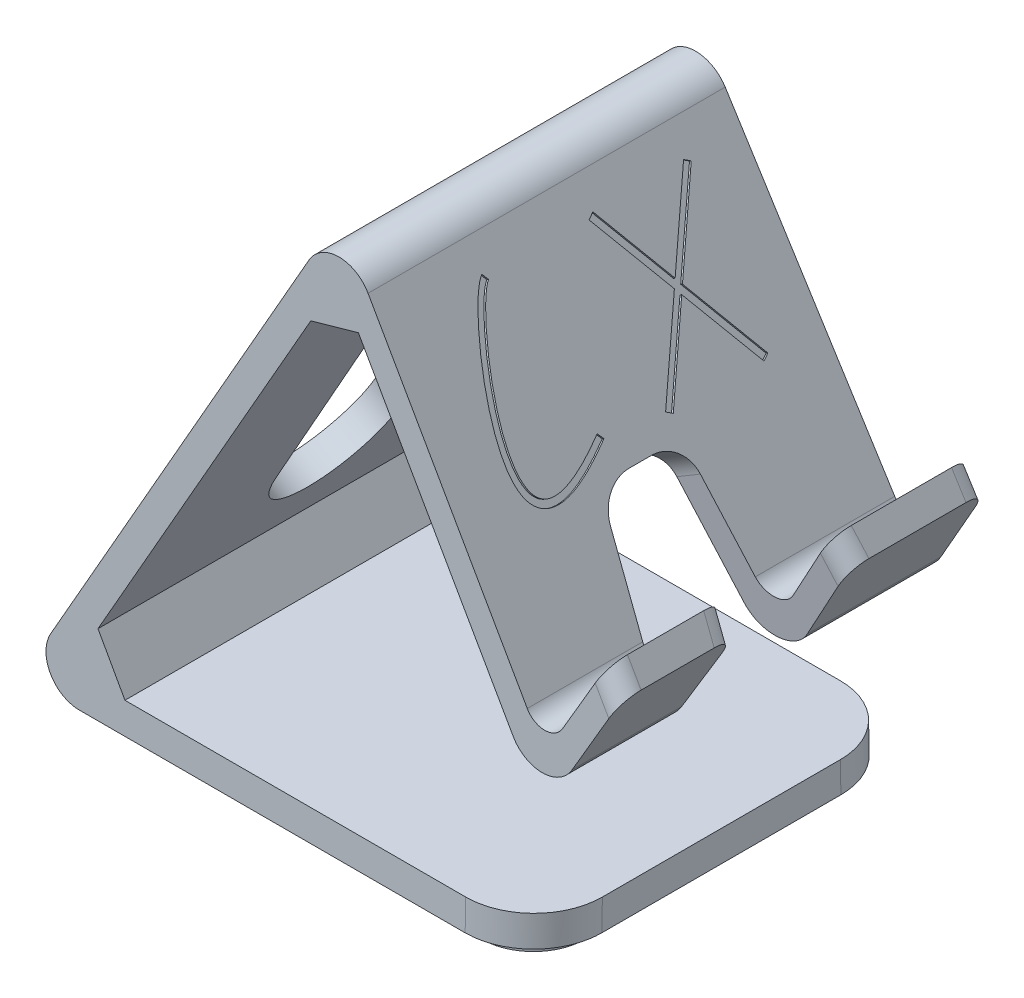
from build123d import *

# Parameters (mm, degrees)
EXTRUDE_6_DEPTH                 = 55
CUT_EXTRUDE_4_DEPTH             = 123.678441464
CUT_EXTRUDE_4_DEPTH_BACK        = 123.678441464
CUT_EXTRUDE_5_REACH             = 115.734
CUT_EXTRUDE_5_DIRECTION_2_DEPTH = 114.733582127
FILLET_2_R                      = 10
CHAMFER_4_SIZE                  = 8
FILLET_4_R                      = 5
CHAMFER_5_SIZE                  = 8
CHAMFER_5_SIZE2                 = 5.863195657
FILLET_5_R                      = 5
FILLET_6_R                      = 3
FILLET_7_R                      = 3
CUT_EXTRUDE_6_REACH             = 111.311
SKETCH_22_R                     = 7.610034459
EXTRUDE_7_DEPTH                 = 2
CUT_EXTRUDE_START               = -0.3
CUT_EXTRUDE_7_DEPTH             = 0.3
FILLET_8_R                      = 5
CUT_EXTRUDE_1_DEPTH             = 0.3


# Read off the part's stored shape, not the designer's step: 切除-拉伸7, 切除-拉伸-薄壁1
with BuildPart() as part:
    # 草图17 → 凸台-拉伸6 (new body)
    with BuildSketch(Plane.XY):
        Polygon((0, 0), (-45, 0), (0, 80), (31.106425199, 28), (39.977057886, 43.36438651), (42.033624536, 39.926464437), (30.873796317, 20.597074957), (0.106425199, 72.030284909), (-37.879360062, 4.5), (-3.8431044, 4.5), (30, 4.5), (30, 0), align=None)
    extrude(amount=EXTRUDE_6_DEPTH)

    # 草图18 → 切除-拉伸4 (cut, two sides: drawn at the far end of the back side and taken through both)
    with BuildSketch(Plane(origin=(30, 0, 0), x_dir=(0, 0, -1), z_dir=(1, 0, 0)).offset(-CUT_EXTRUDE_4_DEPTH_BACK)):
        Polygon((-55, 0), (-53.5, 80), (-55, 80), align=None)
        Polygon((0, 80), (0, 0), (-1.5, 80), align=None)
    extrude(amount=CUT_EXTRUDE_4_DEPTH + CUT_EXTRUDE_4_DEPTH_BACK, mode=Mode.SUBTRACT)

    # 草图20 → 切除-拉伸5 (cut, up to next)
    with BuildSketch(Plane(origin=(35.244140799, 21.083062105, 0), x_dir=(0, 0, -1), z_dir=(0.8581734811109417, 0.5133597922684716, 0)), mode=Mode.PRIVATE) as cut_extrude_5_sk1:
        Polygon((-23.257770773, 29.934997092), (-35.257770773, 29.934997092), (-39.257770773, -0.065002908), (-19.257770773, -0.065002908), align=None)
    cut_extrude_5_tool1 = extrude(cut_extrude_5_sk1.sketch, amount=-CUT_EXTRUDE_5_REACH, mode=Mode.PRIVATE) & part.part
    add(cut_extrude_5_tool1.solids().sort_by_distance((28.218814, 32.827164, 29.257771))[0], mode=Mode.SUBTRACT)

    # 草图20 → 切除-拉伸5 direction 2 (cut)
    with BuildSketch(Plane(origin=(35.244140799, 21.083062105, 0), x_dir=(0, 0, -1), z_dir=(0.8581734811109417, 0.5133597922684716, 0))):
        Polygon((-23.257770773, 29.934997092), (-35.257770773, 29.934997092), (-39.257770773, -0.065002908), (-19.257770773, -0.065002908), align=None)
    extrude(amount=CUT_EXTRUDE_5_DIRECTION_2_DEPTH, mode=Mode.SUBTRACT)

    # 圆角2
    fillet_2_edges = [part.edges().sort_by_distance(p)[0] for p in [
        (30, 2.25, 54.9578125),
        (30, 2.25, 0.0421875),
    ]]
    fillet(fillet_2_edges, radius=FILLET_2_R)

    # 倒角4
    chamfer_4_edges = [part.edges().sort_by_distance(p)[0] for p in [
        (-37.879360062, 4.5, 27.5),
    ]]
    chamfer(chamfer_4_edges, length=CHAMFER_4_SIZE)

    # 圆角4
    fillet_4_edges = [part.edges().sort_by_distance(p)[0] for p in [
        (-45, 0, 27.5),
        (0, 80, 27.5),
    ]]
    fillet(fillet_4_edges, radius=FILLET_4_R)

    # 倒角5
    chamfer_5_edges = [part.edges().sort_by_distance(p)[0] for p in [
        (0.106425199, 72.030284909, 27.5),
    ]]
    chamfer_5_side = [part.faces().sort_by_distance(p)[0] for p in [
        (-17.046062304, 41.536973792, 27.5),
    ]]
    chamfer(chamfer_5_edges, length=CHAMFER_5_SIZE, length2=CHAMFER_5_SIZE2, reference=chamfer_5_side[0])

    # 圆角5
    fillet_5_edges = [part.edges().sort_by_distance(p)[0] for p in [
        (30.873796317, 20.597074957, 9.948083015),
        (30.873796317, 20.597074957, 46.809687758),
    ]]
    fillet(fillet_5_edges, radius=FILLET_5_R)

    # 圆角6
    fillet_6_edges = [part.edges().sort_by_distance(p)[0] for p in [
        (31.106425199, 28, 46.324713893),
        (31.106425199, 28, 10.43305688),
    ]]
    fillet(fillet_6_edges, radius=FILLET_6_R)

    # 圆角7
    fillet_7_edges = [part.edges().sort_by_distance(p)[0] for p in [
        (41.005341211, 41.645425473, 21.224905335),
        (41.005341211, 41.645425473, 37.290636212),
        (41.005341211, 41.645425473, 54.219148272),
        (41.005341211, 41.645425473, 0.780851728),
    ]]
    fillet(fillet_7_edges, radius=FILLET_7_R)

    # 草图21 → 切除-拉伸6 (cut, up to next)
    with BuildSketch(Plane(origin=(-34.183976261, 19.228486647, 0), x_dir=(0, 0, 1), z_dir=(-0.8715755371245492, 0.4902612396325591, 0)), mode=Mode.PRIVATE) as cut_extrude_6_sk1:
        with BuildLine():
            Line((36.595829516, 45.814071294), (36.595829516, 9.320479087))
            ThreePointArc((36.595829516, 9.320479087), (27.509071617, 0.233721188), (18.422313717, 9.320479087))
            Line((18.422313717, 9.320479087), (18.422313717, 45.814071294))
            ThreePointArc((18.422313717, 45.814071294), (27.509071617, 54.900829194), (36.595829516, 45.814071294))
        make_face()
    cut_extrude_6_tool1 = extrude(cut_extrude_6_sk1.sketch, amount=-CUT_EXTRUDE_6_REACH, mode=Mode.PRIVATE) & part.part
    add(cut_extrude_6_tool1.solids().sort_by_distance((-20.66881, 43.255449, 27.509072))[0], mode=Mode.SUBTRACT)

    # 草图22 → 凸台-拉伸7 (add)
    with BuildSketch(Plane.XZ):
        with Locations(Location((20, 44.998242342, 0), (0, 0, 90))):
            Circle(SKETCH_22_R)
        with Locations(Location((20, 10.001757658, 0), (0, 0, 90))):
            Circle(SKETCH_22_R)
        with Locations(Location((-27.513233718, 26.892921796, 0), (0, 0, 90))):
            Circle(SKETCH_22_R)
    extrude(amount=EXTRUDE_7_DEPTH)

    # 切除-拉伸7 outline → 切除-拉伸7 (cut)
    with BuildSketch(Plane(origin=(-34.183976261, 19.228486647, 0), x_dir=(0, 0, 1), z_dir=(-0.8715755371245492, 0.4902612396325591, 0)).offset(CUT_EXTRUDE_START)):
        with BuildLine():
            add(Edge.make_bspline(
                [(20.091441542, -2.755271262), (20.076134397, -2.776993766), (20.048566677, -2.816115363), (20.010320312, -2.86930513), (19.983358443, -2.913234855), (19.958733151, -2.949133213), (19.9376434, -2.988511719), (19.914891341, -3.040593927), (19.880239013, -3.105882728), (19.829606692, -3.218529253), (19.762184157, -3.376781443), (19.714472085, -3.510185447), (19.68976923, -3.579255174)],
                knots=[0, 0, 0, 0, 0.086604777, 0.15597268, 0.213376287, 0.254512607, 0.297729061, 0.358675807, 0.43965503, 0.538420748, 0.76101802, 1, 1, 1, 1], degree=3))
            Line((20.091441542, -2.755271262), (19.732635445, -2.056710721))
            Line((19.732635445, -2.056710721), (19.430984302, -2.263103608))
            Line((19.430984302, -2.263103608), (19.580222236, -2.277392346))
            Line((19.580222236, -2.277392346), (19.411932651, -2.448857207))
            add(Edge.make_bspline(
                [(19.161085911, -3.441130704), (19.182121003, -3.377218318), (19.2262479, -3.243144491), (19.284608985, -3.039580469), (19.336582241, -2.84662122), (19.373494084, -2.681680965), (19.398717089, -2.554150479), (19.408007685, -2.480128863), (19.411932651, -2.448857207)],
                knots=[0, 0, 0, 0, 0.19692034, 0.413094638, 0.619735605, 0.781697444, 0.907774473, 1, 1, 1, 1], degree=3))
            Line((19.161085911, -3.441130704), (17.787779391, -7.407049417))
            add(Edge.make_bspline(
                [(17.254333159, -8.743840272), (17.257653132, -8.707879033), (17.263610586, -8.643349179), (17.269639056, -8.557710587), (17.280095056, -8.496143934), (17.289101292, -8.440126177), (17.322778871, -8.382485197), (17.371291346, -8.313345252), (17.423815093, -8.240474184), (17.470658871, -8.165791172), (17.508431189, -8.08551754), (17.554538675, -7.992881596), (17.606029189, -7.872032207), (17.667523789, -7.725717587), (17.731318887, -7.566870351), (17.769599544, -7.458510525), (17.787779391, -7.407049417)],
                knots=[0, 0, 0, 0, 0.074412067, 0.133527098, 0.176539601, 0.203262751, 0.249574269, 0.31155451, 0.378083901, 0.434356765, 0.492855524, 0.560623601, 0.647507607, 0.763305643, 0.887591607, 1, 1, 1, 1], degree=3))
            Line((17.254333159, -8.743840272), (17.255920796, -9.102646368))
            Line((17.255920796, -9.102646368), (17.251157884, -9.228069738))
            add(Edge.make_bspline(
                [(17.316251025, -9.391596411), (17.311431849, -9.394183906), (17.301117968, -9.399721598), (17.28463909, -9.385556092), (17.27458161, -9.363109337), (17.264118276, -9.322023237), (17.254329189, -9.276144785), (17.251997896, -9.240803806), (17.251157884, -9.228069738)],
                knots=[0, 0, 0, 0, 0.076663169, 0.16407263, 0.283387277, 0.459879146, 0.805383567, 1, 1, 1, 1], degree=3))
            add(Edge.make_bspline(
                [(17.89415111, -8.734314446), (17.859392091, -8.824068524), (17.791680033, -8.998913315), (17.670522096, -9.192240631), (17.566478549, -9.320496638), (17.483528039, -9.378481281), (17.397912072, -9.408670486), (17.343322044, -9.397256546), (17.316251025, -9.391596411)],
                knots=[0, 0, 0, 0, 0.305121637, 0.594390033, 0.721879203, 0.825883103, 0.913655992, 1, 1, 1, 1], degree=3))
            Line((17.89415111, -8.734314446), (18.143410212, -8.040516817))
            Line((18.143410212, -8.040516817), (19.68976923, -3.579255174))
        make_face()
        with BuildLine():
            add(Edge.make_bspline(
                [(32.481365335, -3.20616034), (32.455783647, -3.204896851), (32.40854624, -3.20256378), (32.344047761, -3.179158271), (32.298225284, -3.134927935), (32.272955003, -3.075595917), (32.263765855, -3.007558666), (32.263388366, -2.932603657), (32.277000859, -2.851331222), (32.294344308, -2.796876193), (32.303549924, -2.767972363)],
                knots=[0, 0, 0, 0, 0.132741281, 0.245111035, 0.348211214, 0.454063146, 0.573894196, 0.703170557, 0.842447835, 1, 1, 1, 1], degree=3))
            add(Edge.make_bspline(
                [(33.130709111, -2.745745437), (33.101557213, -2.798610192), (33.039333464, -2.91144824), (32.93290227, -3.038114669), (32.82656461, -3.13147901), (32.724506715, -3.178925122), (32.607780553, -3.206859983), (32.524932923, -3.206401464), (32.481365335, -3.20616034)],
                knots=[0, 0, 0, 0, 0.21267392, 0.453945354, 0.579961607, 0.708593919, 0.846756507, 1, 1, 1, 1], degree=3))
            add(Edge.make_bspline(
                [(32.303549924, -2.767972363), (32.31563674, -2.738309273), (32.344164313, -2.668297788), (32.394065532, -2.552402402), (32.472203674, -2.426122966), (32.559136174, -2.325085964), (32.648786335, -2.257023765), (32.734093895, -2.226022823), (32.831236666, -2.211859979), (32.934411912, -2.217642757), (33.031575375, -2.236722945), (33.112313955, -2.273826448), (33.165942265, -2.335797581), (33.18575091, -2.44238248), (33.180448788, -2.582149275), (33.147462749, -2.690641926), (33.130709111, -2.745745437)],
                knots=[0, 0, 0, 0, 0.060260207, 0.142227483, 0.236978024, 0.338488368, 0.391253471, 0.446710231, 0.507101831, 0.574854247, 0.640065641, 0.6925955, 0.739241005, 0.787525155, 0.892083842, 1, 1, 1, 1], degree=3))
        make_face()
        with BuildLine():
            add(Edge.make_bspline(
                [(34.98030691, -5.836875835), (34.990425973, -5.79296609), (35.009426465, -5.710517073), (35.035346716, -5.593661262), (35.055827278, -5.490941515), (35.078251535, -5.368648856), (35.096795379, -5.213527803), (35.099309901, -5.053642902), (35.095326123, -4.921886882), (35.080899881, -4.829821245), (35.058802228, -4.74693778), (35.027908058, -4.673988924), (34.986159595, -4.611023519), (34.930620512, -4.561977886), (34.861411615, -4.527924514), (34.810244134, -4.51694835), (34.783439848, -4.511198443)],
                knots=[0, 0, 0, 0, 0.090904411, 0.170690567, 0.241460043, 0.30219241, 0.421507994, 0.556066006, 0.624468594, 0.687131505, 0.743594276, 0.797145731, 0.846302562, 0.894711718, 0.94484432, 1, 1, 1, 1], degree=3))
            Line((34.98030691, -5.836875835), (35.307360254, -5.786071432))
            Line((35.307360254, -5.786071432), (35.426433074, -5.733679391))
            Line((35.426433074, -5.733679391), (35.534392431, -5.385986758))
            add(Edge.make_bspline(
                [(35.021585487, -3.985690399), (35.06522038, -3.998159596), (35.157445671, -4.024514086), (35.271570518, -4.071379618), (35.36400925, -4.124065065), (35.430559604, -4.180850955), (35.488310281, -4.255179269), (35.541383326, -4.34302772), (35.585259732, -4.447847424), (35.612193713, -4.570797999), (35.626618868, -4.710870104), (35.623392223, -4.862372785), (35.610421401, -5.01319767), (35.593868177, -5.15335781), (35.569843746, -5.276366327), (35.54563048, -5.351237136), (35.534392431, -5.385986758)],
                knots=[0, 0, 0, 0, 0.079309321, 0.167625607, 0.2149077, 0.26477983, 0.319394775, 0.378734052, 0.443850111, 0.517006848, 0.597924044, 0.689518136, 0.781406105, 0.862534574, 0.936198479, 1, 1, 1, 1], degree=3))
            add(Edge.make_bspline(
                [(32.883037647, -6.244898697), (32.943178094, -6.099626097), (33.061906429, -5.812831191), (33.234324418, -5.469912238), (33.376072066, -5.212048119), (33.481275059, -5.037869854), (33.581537931, -4.87938548), (33.715036369, -4.699907455), (33.877682233, -4.505411804), (34.080750059, -4.308242371), (34.295880846, -4.154486897), (34.489544406, -4.062077398), (34.650399084, -4.010537944), (34.773393973, -3.986121188), (34.897746838, -3.978440842), (34.980323984, -3.983274936), (35.021585487, -3.985690399)],
                knots=[0, 0, 0, 0, 0.142303331, 0.280933022, 0.347199509, 0.408660365, 0.465140664, 0.516886908, 0.611052707, 0.694418082, 0.77244854, 0.849384336, 0.88756924, 0.925154296, 0.962601684, 1, 1, 1, 1], degree=3))
            add(Edge.make_bspline(
                [(33.227555005, -9.170914785), (33.188900028, -9.171764975), (33.114047395, -9.173411308), (33.003842104, -9.161714633), (32.900179554, -9.1396773), (32.802596147, -9.108698468), (32.716053, -9.066253889), (32.640546913, -9.014954134), (32.57921136, -8.952516817), (32.517181526, -8.853370026), (32.465192426, -8.711046565), (32.424292896, -8.524425275), (32.403698965, -8.31889787), (32.399016216, -8.134088605), (32.407717508, -7.973098459), (32.420701153, -7.838083349), (32.439712481, -7.69130799), (32.47626979, -7.478763491), (32.537422601, -7.204654319), (32.639442257, -6.878260918), (32.756240613, -6.55836107), (32.841172637, -6.34839564), (32.883037647, -6.244898697)],
                knots=[0, 0, 0, 0, 0.032970742, 0.063845513, 0.094317936, 0.123311871, 0.150984664, 0.176293413, 0.200886792, 0.225066105, 0.275556496, 0.32924826, 0.387853738, 0.451551365, 0.486826669, 0.525386919, 0.567291064, 0.613104455, 0.709416956, 0.806711446, 0.904723485, 1, 1, 1, 1], degree=3))
            add(Edge.make_bspline(
                [(34.929502507, -7.264162033), (34.907303104, -7.32185676), (34.865551306, -7.430366821), (34.806730836, -7.582018436), (34.757395049, -7.712892509), (34.703721599, -7.856508532), (34.64048809, -8.016537613), (34.555145512, -8.197277899), (34.451535377, -8.373460006), (34.334819451, -8.551644447), (34.196945859, -8.722276014), (34.039611804, -8.873949707), (33.863053039, -9.003024665), (33.664636054, -9.097245682), (33.450194078, -9.158631262), (33.302048459, -9.166804805), (33.227555005, -9.170914785)],
                knots=[0, 0, 0, 0, 0.067695664, 0.127319444, 0.178123223, 0.220855275, 0.29521794, 0.366502184, 0.439462837, 0.518864455, 0.599599942, 0.679115683, 0.757600488, 0.837954442, 0.918517109, 1, 1, 1, 1], degree=3))
            Line((34.929502507, -7.264162033), (34.519892007, -7.264162033))
            Line((34.519892007, -7.264162033), (34.350014785, -7.62931868))
            add(Edge.make_bspline(
                [(33.372030026, -8.63270564), (33.422824729, -8.63223357), (33.519179092, -8.631338081), (33.652965212, -8.578573561), (33.76470057, -8.499191407), (33.85277216, -8.421313338), (33.922072181, -8.34570207), (33.978188616, -8.273416528), (34.042966692, -8.189816862), (34.131201983, -8.054112322), (34.243079891, -7.870105937), (34.314137329, -7.710104604), (34.350014785, -7.62931868)],
                knots=[0, 0, 0, 0, 0.102145031, 0.19376271, 0.285662339, 0.379075945, 0.43144347, 0.493238321, 0.564439619, 0.645630794, 0.821076217, 1, 1, 1, 1], degree=3))
            add(Edge.make_bspline(
                [(33.154523675, -7.1276252), (33.128011412, -7.239459316), (33.077446752, -7.452751334), (33.03765382, -7.717267568), (33.025461569, -7.913371657), (33.020793088, -8.046391223), (33.027515879, -8.168965934), (33.040903217, -8.279529007), (33.062463413, -8.375311732), (33.089709471, -8.454518618), (33.119495733, -8.518258686), (33.171839144, -8.577127602), (33.258099137, -8.621819545), (33.3328417, -8.628961196), (33.372030026, -8.63270564)],
                knots=[0, 0, 0, 0, 0.202646971, 0.38649191, 0.470668421, 0.549081373, 0.62103644, 0.686899776, 0.745306418, 0.793708227, 0.83461066, 0.86832314, 0.930960414, 1, 1, 1, 1], degree=3))
            add(Edge.make_bspline(
                [(34.783439848, -4.511198443), (34.749316471, -4.510231873), (34.678790491, -4.508234173), (34.571152078, -4.546558122), (34.46030601, -4.615810813), (34.365075629, -4.698597008), (34.281824017, -4.786208347), (34.210144039, -4.872595412), (34.133799498, -4.9778971), (34.016208713, -5.141002804), (33.872690507, -5.37293392), (33.73488769, -5.622544863), (33.624560143, -5.841364012), (33.546211226, -6.02963204), (33.459757544, -6.233994899), (33.382453499, -6.451403196), (33.309080914, -6.660683183), (33.245410036, -6.84532271), (33.193899738, -6.996831325), (33.166492283, -7.08786956), (33.154523675, -7.1276252)],
                knots=[0, 0, 0, 0, 0.03168376, 0.065483796, 0.104774276, 0.153560844, 0.182959816, 0.217741629, 0.258416085, 0.304548336, 0.405726053, 0.513142424, 0.571120559, 0.634729114, 0.703737933, 0.778565028, 0.850395376, 0.911110879, 0.96118286, 1, 1, 1, 1], degree=3))
        make_face()
        with BuildLine():
            add(Edge.make_bspline(
                [(37.518939425, -3.952350009), (37.560884339, -3.95552987), (37.641275307, -3.961624342), (37.755098372, -3.987176368), (37.856218481, -4.025111889), (37.942248999, -4.074042974), (38.009980667, -4.124399526), (38.048611471, -4.157226326), (38.063985043, -4.172047521)],
                knots=[0, 0, 0, 0, 0.178391452, 0.341902266, 0.493362436, 0.635202899, 0.760572083, 0.850879147, 0.850879147, 0.850879147, 0.850879147], degree=3))
            add(Edge.make_bspline(
                [(36.088477951, -5.346295818), (36.122925392, -5.25333364), (36.188323612, -5.076845609), (36.315812467, -4.834276207), (36.461618977, -4.618224694), (36.620031668, -4.412926931), (36.805288641, -4.228255666), (36.984150795, -4.102593414), (37.137836703, -4.022301835), (37.260600166, -3.98156291), (37.388270256, -3.956688818), (37.474899468, -3.953812336), (37.518939425, -3.952350009)],
                knots=[0, 0, 0, 0, 0.140200367, 0.266169397, 0.386657082, 0.508781927, 0.632719337, 0.755318714, 0.816618402, 0.877491037, 0.937719745, 1, 1, 1, 1], degree=3))
            add(Edge.make_bspline(
                [(36.963266266, -7.472142558), (36.970315846, -7.414531571), (36.983296243, -7.308452404), (36.976562496, -7.161500833), (36.955869582, -7.041936905), (36.906673589, -6.950568206), (36.83397502, -6.887677294), (36.74011987, -6.838883238), (36.614392364, -6.795211758), (36.456799702, -6.759678691), (36.286276184, -6.711862024), (36.152267762, -6.647491951), (36.0623326, -6.577528252), (36.008410708, -6.509556783), (35.967108504, -6.427457471), (35.939817301, -6.330986251), (35.921957253, -6.224436745), (35.920419444, -6.108233334), (35.927650263, -5.984873856), (35.957318066, -5.811645245), (36.007793571, -5.596698141), (36.061978344, -5.428536807), (36.088477951, -5.346295818)],
                knots=[0, 0, 0, 0, 0.063236965, 0.116438285, 0.160178163, 0.194576117, 0.227298254, 0.263492898, 0.309544855, 0.37217989, 0.439801385, 0.50258545, 0.532991805, 0.56339816, 0.596470331, 0.632660365, 0.672456655, 0.714069218, 0.759224602, 0.807190063, 0.905704364, 1, 1, 1, 1], degree=3))
            add(Edge.make_bspline(
                [(36.045611736, -8.664458392), (36.095561579, -8.65526792), (36.192962238, -8.637346782), (36.305509902, -8.579335407), (36.388281822, -8.514912939), (36.454302934, -8.451191591), (36.524337621, -8.371829105), (36.625785965, -8.24817901), (36.743253604, -8.07236372), (36.827135571, -7.878240506), (36.880137175, -7.726686793), (36.916063018, -7.628240074), (36.942892896, -7.545041921), (36.957043948, -7.494407066), (36.963266266, -7.472142558)],
                knots=[0, 0, 0, 0, 0.09570088, 0.18661378, 0.235886507, 0.293967924, 0.359916271, 0.436082225, 0.596619455, 0.757982235, 0.834640329, 0.900520213, 0.956258025, 1, 1, 1, 1], degree=3))
            add(Edge.make_bspline(
                [(35.788414446, -7.400698866), (35.774053463, -7.443010201), (35.747536352, -7.521136777), (35.712287112, -7.62832655), (35.68648101, -7.716778788), (35.661871783, -7.812065075), (35.644000391, -7.932206971), (35.622634811, -8.084219958), (35.621593181, -8.248585063), (35.644131352, -8.384000184), (35.678807653, -8.481959934), (35.714453898, -8.543312397), (35.756098447, -8.594189546), (35.805849289, -8.633106561), (35.862282162, -8.658213886), (35.921435308, -8.672515629), (35.983604324, -8.676595859), (36.024526444, -8.668585673), (36.045611736, -8.664458392)],
                knots=[0, 0, 0, 0, 0.086270078, 0.159295038, 0.217821059, 0.264161805, 0.349157892, 0.452066215, 0.560372024, 0.665195108, 0.715302688, 0.760166833, 0.801506809, 0.841564214, 0.880885111, 0.919792303, 0.958672652, 1, 1, 1, 1], degree=3))
            Line((35.788414446, -7.400698866), (35.388329772, -7.400698866))
            Line((35.388329772, -7.400698866), (35.258143489, -7.810309366))
            add(Edge.make_bspline(
                [(35.856682862, -9.18044061), (35.816969398, -9.181375542), (35.739948754, -9.183188756), (35.628365758, -9.170489954), (35.526043269, -9.144991757), (35.433447893, -9.108891603), (35.353385908, -9.062409792), (35.283191078, -9.012595391), (35.229651349, -8.953795121), (35.183812867, -8.892898662), (35.155095038, -8.822516142), (35.131676939, -8.746765467), (35.119756124, -8.662736045), (35.116679852, -8.539971419), (35.127545403, -8.380582285), (35.153528728, -8.187096993), (35.198153094, -7.996203667), (35.238243373, -7.87197454), (35.258143489, -7.810309366)],
                knots=[0, 0, 0, 0, 0.063564714, 0.123277966, 0.179189226, 0.232069906, 0.281793244, 0.327221142, 0.369188832, 0.408696801, 0.448539704, 0.490103229, 0.535531127, 0.583870039, 0.686592575, 0.790990187, 0.89625117, 1, 1, 1, 1], degree=3))
            add(Edge.make_bspline(
                [(37.447495733, -7.7610926), (37.403034206, -7.863748505), (37.315750059, -8.065276292), (37.153641313, -8.34025535), (36.985450962, -8.582746013), (36.806909679, -8.786376777), (36.607996257, -8.94980942), (36.423158107, -9.054341545), (36.26345817, -9.122298608), (36.133488321, -9.153305641), (35.997861149, -9.178119797), (35.904439131, -9.179655551), (35.856682862, -9.18044061)],
                knots=[0, 0, 0, 0, 0.147913284, 0.290374302, 0.421530029, 0.538081342, 0.64757001, 0.760494328, 0.81797662, 0.876578541, 0.936908359, 1, 1, 1, 1], degree=3))
            add(Edge.make_bspline(
                [(36.952152803, -6.236960509), (36.993693176, -6.251099665), (37.073150129, -6.278144543), (37.183051657, -6.327647241), (37.279729878, -6.381007623), (37.361838819, -6.442583988), (37.432422152, -6.509092233), (37.490991949, -6.583069178), (37.535161237, -6.665149404), (37.569269073, -6.75365005), (37.590694262, -6.849969734), (37.603952838, -6.95469277), (37.60433008, -7.06850346), (37.596447855, -7.191633611), (37.577635192, -7.322953522), (37.544402776, -7.462020988), (37.50200261, -7.609513127), (37.466076095, -7.709422028), (37.447495733, -7.7610926)],
                knots=[0, 0, 0, 0, 0.070389843, 0.134639198, 0.193214667, 0.247234609, 0.298899523, 0.348512966, 0.397929716, 0.447934221, 0.500265091, 0.555890456, 0.617050703, 0.68258962, 0.753819984, 0.82964225, 0.911894913, 1, 1, 1, 1], degree=3))
            Line((36.952152803, -6.236960509), (36.658439848, -6.162341542))
            add(Edge.make_bspline(
                [(36.526665928, -5.814648909), (36.523182058, -5.845317889), (36.516944678, -5.900226388), (36.519415438, -5.975135506), (36.524589862, -6.033650307), (36.54576352, -6.088399084), (36.590992311, -6.135198291), (36.635901167, -6.153271187), (36.658439848, -6.162341542)],
                knots=[0, 0, 0, 0, 0.224436886, 0.401822697, 0.545765461, 0.649572655, 0.824128896, 1, 1, 1, 1], degree=3))
            add(Edge.make_bspline(
                [(37.342711652, -4.490559154), (37.324928576, -4.49330689), (37.285928046, -4.499333022), (37.228063128, -4.532695217), (37.160815235, -4.575661402), (37.066597568, -4.663992017), (36.946403001, -4.792214484), (36.827348719, -4.980094095), (36.723017184, -5.190302667), (36.639851361, -5.37440206), (36.581890756, -5.524194829), (36.552098812, -5.629514508), (36.530898339, -5.724905836), (36.528018127, -5.785977179), (36.526665928, -5.814648909)],
                knots=[0, 0, 0, 0, 0.033028618, 0.072435927, 0.121857776, 0.180806346, 0.310419263, 0.446197917, 0.590259513, 0.744545017, 0.819832575, 0.887076369, 0.946984696, 1, 1, 1, 1], degree=3))
            add(Edge.make_bspline(
                [(37.36335094, -6.182980831), (37.381801737, -6.116809161), (37.41708273, -5.990277919), (37.468200462, -5.811257051), (37.510706835, -5.650502151), (37.561994077, -5.465713516), (37.611348799, -5.250283147), (37.629875309, -5.040400412), (37.633369353, -4.88378641), (37.618661485, -4.781853588), (37.594438776, -4.693648856), (37.555632539, -4.621479022), (37.509786357, -4.564532961), (37.460005523, -4.520234383), (37.402464722, -4.495342165), (37.362498168, -4.492142991), (37.342711652, -4.490559154)],
                knots=[0, 0, 0, 0, 0.110431569, 0.211163531, 0.299283211, 0.377703078, 0.51953331, 0.653706611, 0.715810121, 0.770792754, 0.818706472, 0.862093856, 0.901421285, 0.935841821, 0.968236769, 1, 1, 1, 1], degree=3))
            Line((37.36335094, -6.182980831), (37.755497426, -6.182980831))
            Line((37.755497426, -6.182980831), (38.481047807, -4.08412393))
            Line((38.481047807, -4.08412393), (38.14923155, -4.04443299))
            Line((38.14923155, -4.04443299), (38.063985043, -4.172047521))
        make_face()
        with BuildLine():
            add(Edge.make_bspline(
                [(29.906217155, -4.155567621), (29.933244798, -4.147755514), (29.989694946, -4.131439084), (30.072789642, -4.104758656), (30.147153738, -4.075696912), (30.191045121, -4.053671738), (30.209455936, -4.04443299)],
                knots=[0, 0, 0, 0, 0.260854252, 0.544822261, 0.809069733, 1, 1, 1, 1], degree=3))
            Line((29.906217155, -4.155567621), (29.791174106, -4.188322934))
            Line((29.791174106, -4.188322934), (29.82366, -4.093649755))
            add(Edge.make_bspline(
                [(30.369807333, -2.883869908), (30.35392879, -2.906624206), (30.324776701, -2.948399784), (30.285406539, -3.004885686), (30.254449144, -3.050220867), (30.230184484, -3.087565504), (30.209159701, -3.125853809), (30.183175805, -3.169407021), (30.155402686, -3.22571506), (30.127174836, -3.280918413), (30.100571139, -3.337307658), (30.077164516, -3.397746221), (30.04645241, -3.473528976), (30.012470465, -3.566514492), (29.972453744, -3.675600348), (29.925978728, -3.799963598), (29.877727275, -3.941983391), (29.842319816, -4.041306331), (29.82366, -4.093649755)],
                knots=[0, 0, 0, 0, 0.06240537, 0.11457266, 0.154847826, 0.185885492, 0.21467356, 0.253057651, 0.299902334, 0.35579295, 0.392536494, 0.440056748, 0.501501274, 0.576448608, 0.662681486, 0.762845693, 0.875019117, 1, 1, 1, 1], degree=3))
            Line((30.369807333, -2.883869908), (30.007825962, -2.151968976))
            Line((30.007825962, -2.151968976), (29.69823663, -2.3345473))
            Line((29.69823663, -2.3345473), (29.676009704, -2.548878375))
            add(Edge.make_bspline(
                [(29.402936038, -3.609420289), (29.42906995, -3.53291468), (29.478166048, -3.38918852), (29.537339488, -3.180017168), (29.586507608, -2.986316587), (29.618052065, -2.832058636), (29.641789168, -2.718792559), (29.655762915, -2.649401078), (29.667390983, -2.594465931), (29.673406723, -2.562646491), (29.676009704, -2.548878375)],
                knots=[0, 0, 0, 0, 0.221198343, 0.415551081, 0.594685699, 0.767952084, 0.846343339, 0.911384271, 0.961656406, 1, 1, 1, 1], degree=3))
            Line((29.402936038, -3.609420289), (29.15050166, -4.339733583))
            Line((29.15050166, -4.339733583), (29.015552464, -4.365135784))
            add(Edge.make_bspline(
                [(28.651983455, -4.371486334), (28.692240879, -4.372327098), (28.76536693, -4.373854314), (28.864993298, -4.378895742), (28.947299208, -4.384059509), (28.994511987, -4.370969414), (29.015552464, -4.365135784)],
                knots=[0, 0, 0, 0, 0.330407177, 0.600171838, 0.821815711, 1, 1, 1, 1], degree=3))
            Line((28.651983455, -4.371486334), (28.51703426, -4.373073972))
            Line((28.51703426, -4.373073972), (28.347157037, -4.349259408))
            add(Edge.make_bspline(
                [(28.374146876, -5.016067198), (28.340294806, -4.982710607), (28.278832642, -4.922148038), (28.199839973, -4.830223013), (28.149376317, -4.730026665), (28.140332707, -4.621981329), (28.151689407, -4.522690592), (28.187663789, -4.437511348), (28.257788915, -4.379281361), (28.315514267, -4.359889348), (28.347157037, -4.349259408)],
                knots=[0, 0, 0, 0, 0.169177584, 0.307160555, 0.430187475, 0.561042164, 0.686525295, 0.784284758, 0.881753378, 1, 1, 1, 1], degree=3))
            Line((28.374146876, -5.016067198), (28.950459323, -4.88905619))
            Line((28.950459323, -4.88905619), (27.934371262, -7.850000306))
            add(Edge.make_bspline(
                [(28.245548231, -9.150275496), (28.20090741, -9.148757927), (28.117439695, -9.145920433), (28.002828576, -9.117482983), (27.907976763, -9.07135932), (27.834714346, -9.003591084), (27.785282493, -8.916176655), (27.755566284, -8.812991617), (27.743525286, -8.694301611), (27.751648321, -8.558811154), (27.776902911, -8.406802157), (27.815427586, -8.236741569), (27.86836669, -8.048787969), (27.911586504, -7.918621748), (27.934371262, -7.850000306)],
                knots=[0, 0, 0, 0, 0.081503897, 0.152392901, 0.214287914, 0.272493983, 0.331918366, 0.395603484, 0.467639368, 0.54902826, 0.643066179, 0.749195785, 0.867780238, 1, 1, 1, 1], degree=3))
            add(Edge.make_bspline(
                [(29.601390737, -7.502307672), (29.573271134, -7.583252515), (29.521260914, -7.732968675), (29.450921318, -7.938686056), (29.39087539, -8.105284485), (29.333187434, -8.278737922), (29.254926696, -8.470385985), (29.154333161, -8.648200445), (29.057782466, -8.784867617), (28.971141465, -8.878212752), (28.871401806, -8.958907485), (28.762659314, -9.030839286), (28.643746884, -9.087928187), (28.516768192, -9.128621888), (28.382754434, -9.148739717), (28.291645787, -9.149759516), (28.245548231, -9.150275496)],
                knots=[0, 0, 0, 0, 0.110796845, 0.204930639, 0.281109304, 0.339753295, 0.441288476, 0.548229639, 0.603116468, 0.657342452, 0.71227618, 0.768644429, 0.825570609, 0.882270146, 0.940433111, 1, 1, 1, 1], degree=3))
            Line((29.601390737, -7.502307672), (29.85064984, -6.779932566))
            Line((29.85064984, -6.779932566), (29.412461863, -6.779932566))
            Line((29.412461863, -6.779932566), (29.136212922, -7.508658223))
            add(Edge.make_bspline(
                [(28.52338481, -8.537447384), (28.556994845, -8.532486085), (28.623457647, -8.52267527), (28.697940391, -8.472414727), (28.748576827, -8.411770921), (28.789699405, -8.345313124), (28.831471168, -8.259034442), (28.877583143, -8.152696019), (28.930418825, -8.024564211), (28.989286489, -7.872940504), (29.060511044, -7.69884796), (29.109864493, -7.574854742), (29.136212922, -7.508658223)],
                knots=[0, 0, 0, 0, 0.080768536, 0.159717272, 0.208371268, 0.270063619, 0.346782152, 0.438388989, 0.548356259, 0.67955514, 0.828923429, 1, 1, 1, 1], degree=3))
            add(Edge.make_bspline(
                [(28.548787011, -7.775381339), (28.535527005, -7.814532073), (28.51029539, -7.889029488), (28.474887987, -7.995094775), (28.446551993, -8.089926455), (28.423841612, -8.172419968), (28.408133523, -8.242989355), (28.396229857, -8.301095468), (28.391170684, -8.347799201), (28.39051568, -8.406620637), (28.406761167, -8.463881457), (28.419741181, -8.53071256), (28.472057781, -8.55171173), (28.503996032, -8.542835739), (28.52338481, -8.537447384)],
                knots=[0, 0, 0, 0, 0.140957418, 0.268218805, 0.381263952, 0.478446085, 0.559874561, 0.627830206, 0.680443669, 0.720145461, 0.826679603, 0.889011113, 0.932621892, 1, 1, 1, 1], degree=3))
            Line((28.548787011, -7.775381339), (29.582000985, -4.79318616))
            add(Edge.make_bspline(
                [(30.27296144, -4.658848739), (30.228498696, -4.666199722), (30.130471283, -4.6824065), (29.970296423, -4.710306751), (29.78475601, -4.749470729), (29.652485244, -4.777987784), (29.582000985, -4.79318616)],
                knots=[0, 0, 0, 0, 0.191253505, 0.421658323, 0.689893908, 0.995894231, 0.995894231, 0.995894231, 0.995894231], degree=3))
            Line((30.27296144, -4.658848739), (30.423787011, -4.636621813))
            add(Edge.make_bspline(
                [(30.730201067, -4.290516817), (30.739137847, -4.307802204), (30.75509075, -4.338658072), (30.770337343, -4.381959047), (30.781501322, -4.415976328), (30.775988302, -4.455655854), (30.741490244, -4.50310924), (30.698896378, -4.553764352), (30.645124812, -4.598199595), (30.583637655, -4.620613089), (30.508583904, -4.634481176), (30.45350578, -4.635871584), (30.423787011, -4.636621813)],
                knots=[0, 0, 0, 0, 0.098305841, 0.175484183, 0.233348541, 0.276570541, 0.372658672, 0.522695674, 0.614383381, 0.721402739, 0.849675937, 1, 1, 1, 1], degree=3))
            Line((30.730201067, -4.290516817), (30.4444263, -3.960288197))
            Line((30.4444263, -3.960288197), (30.209455936, -4.04443299))
        make_face()
        with BuildLine():
            add(Edge.make_bspline(
                [(32.48454061, -4.617570162), (32.468410419, -4.640157399), (32.43871235, -4.681743847), (32.401232264, -4.741597319), (32.368611485, -4.789639564), (32.344767943, -4.833180675), (32.322045873, -4.877397458), (32.294933315, -4.929729994), (32.262239608, -4.994623957), (32.22060828, -5.071454914), (32.178051868, -5.165756247), (32.133348887, -5.280299855), (32.086464769, -5.415422069), (32.05610067, -5.513428354), (32.040002083, -5.565389806)],
                knots=[0, 0, 0, 0, 0.07912457, 0.145680047, 0.201354128, 0.244595112, 0.287119125, 0.343139834, 0.412657741, 0.494331713, 0.592250279, 0.707428922, 0.844883233, 1, 1, 1, 1], degree=3))
            Line((32.48454061, -4.617570162), (32.095569399, -3.907896157))
            Line((32.095569399, -3.907896157), (31.797093531, -4.114289044))
            Line((31.797093531, -4.114289044), (31.944743828, -4.126990145))
            Line((31.944743828, -4.126990145), (31.77169133, -4.307980831))
            add(Edge.make_bspline(
                [(31.506555851, -5.408213684), (31.512439513, -5.389710357), (31.528015991, -5.34072442), (31.554326983, -5.249638039), (31.58933635, -5.12303007), (31.630493765, -4.972701225), (31.67206836, -4.821560517), (31.705378495, -4.692952068), (31.728586665, -4.599455603), (31.744359021, -4.515719634), (31.75697099, -4.422369805), (31.766446911, -4.348734217), (31.77169133, -4.307980831)],
                knots=[0, 0, 0, 0, 0.051389737, 0.136049823, 0.250918075, 0.399077777, 0.548588697, 0.665798766, 0.750736502, 0.8034828, 0.891238169, 1, 1, 1, 1], degree=3))
            Line((31.506555851, -5.408213684), (30.86038735, -7.270512583))
            add(Edge.make_bspline(
                [(30.317415293, -8.480292431), (30.324416647, -8.465232849), (30.343455696, -8.42428076), (30.392322323, -8.362345974), (30.446236754, -8.288772561), (30.49738688, -8.208802357), (30.545185607, -8.1215876), (30.588968167, -8.023521826), (30.63039977, -7.927317333), (30.659658643, -7.857212993), (30.67395581, -7.807248397), (30.689467342, -7.769940956), (30.705924512, -7.718593731), (30.728790403, -7.654783455), (30.755765743, -7.577690887), (30.785024026, -7.48652328), (30.822900398, -7.383630418), (30.847383385, -7.30975238), (30.86038735, -7.270512583)],
                knots=[0, 0, 0, 0, 0.037267531, 0.101343006, 0.176351913, 0.242730491, 0.314652865, 0.399877376, 0.484131875, 0.550457055, 0.570412929, 0.600927008, 0.641209871, 0.691660984, 0.753404836, 0.82493203, 0.907013886, 1, 1, 1, 1], degree=3))
            add(Edge.make_bspline(
                [(30.280899628, -8.808933413), (30.280491607, -8.783531054), (30.279752032, -8.737486973), (30.277195638, -8.676630119), (30.278213226, -8.631143092), (30.276310237, -8.588828575), (30.289035659, -8.53848299), (30.307025712, -8.501595577), (30.317415293, -8.480292431)],
                knots=[0, 0, 0, 0, 0.226938291, 0.411346241, 0.543698192, 0.633508444, 0.788344527, 1, 1, 1, 1], degree=3))
            Line((30.280899628, -8.808933413), (30.276136715, -9.186791161))
            add(Edge.make_bspline(
                [(30.393621897, -9.505906317), (30.376651375, -9.504412362), (30.344444087, -9.501577079), (30.31170264, -9.45865849), (30.300666173, -9.401990585), (30.285861267, -9.334444937), (30.276286877, -9.260610033), (30.276185205, -9.210628683), (30.276136715, -9.186791161)],
                knots=[0, 0, 0, 0, 0.13155174, 0.24966379, 0.401005386, 0.596976777, 0.807786799, 1, 1, 1, 1], degree=3))
            add(Edge.make_bspline(
                [(30.925480492, -8.816871601), (30.896028238, -8.896026361), (30.836751135, -9.055337252), (30.753020432, -9.247151061), (30.672672979, -9.38679577), (30.591987843, -9.459983059), (30.496543848, -9.503531405), (30.428469263, -9.505102218), (30.393621897, -9.505906317)],
                knots=[0, 0, 0, 0, 0.27081364, 0.545053296, 0.671735395, 0.78353013, 0.889189119, 1, 1, 1, 1], degree=3))
            Line((30.925480492, -8.816871601), (31.057254412, -8.437426216))
            Line((31.057254412, -8.437426216), (32.040002083, -5.565389806))
        make_face()
        with BuildLine():
            add(Edge.make_bspline(
                [(20.642351787, -5.254212837), (20.64728475, -5.207658296), (20.656362783, -5.121984909), (20.666390859, -5.004876626), (20.677421047, -4.910899481), (20.683199699, -4.813968817), (20.688620251, -4.704397184), (20.684302681, -4.578848767), (20.677868284, -4.466743778), (20.674096076, -4.398477347), (20.672516901, -4.369898697)],
                knots=[0, 0, 0, 0, 0.158396884, 0.2914946, 0.397686318, 0.478443273, 0.62000455, 0.768669504, 0.903157187, 1, 1, 1, 1], degree=3))
            Line((20.642351787, -5.254212837), (20.150184133, -9.226482101))
            Line((20.150184133, -9.226482101), (20.305772617, -9.216956275))
            Line((20.305772617, -9.216956275), (19.853295902, -9.753577782))
            add(Edge.make_bspline(
                [(19.110281508, -9.588463472), (19.105834037, -9.640837153), (19.097573857, -9.738109513), (19.089229922, -9.87257063), (19.086396916, -9.984809782), (19.085186481, -10.075960816), (19.090112348, -10.148561437), (19.097305564, -10.205732714), (19.108867713, -10.249021156), (19.13241724, -10.291812024), (19.196009218, -10.316281465), (19.268140373, -10.316228008), (19.340938219, -10.301121278), (19.403994179, -10.272119468), (19.473304915, -10.23405226), (19.547324294, -10.18033144), (19.626156224, -10.10870931), (19.703167183, -10.011497037), (19.781050532, -9.891792264), (19.828160496, -9.801664976), (19.853295902, -9.753577782)],
                knots=[0, 0, 0, 0, 0.093460519, 0.173581941, 0.239477307, 0.293113075, 0.335551096, 0.368819705, 0.395317897, 0.415167858, 0.453041507, 0.507650691, 0.543271415, 0.584168808, 0.630506619, 0.683777964, 0.746379552, 0.819273497, 0.903573817, 1, 1, 1, 1], degree=3))
            Line((19.110281508, -9.588463472), (18.710196834, -9.588463472))
            Line((18.710196834, -9.588463472), (18.578422913, -10.029826724))
            add(Edge.make_bspline(
                [(19.02931199, -10.895089213), (18.972126028, -10.898233207), (18.862156763, -10.904279142), (18.726733011, -10.875913125), (18.633445821, -10.823790731), (18.579503265, -10.75837617), (18.538504445, -10.673611301), (18.511286449, -10.569112584), (18.498756836, -10.448678322), (18.506100256, -10.316670066), (18.532119866, -10.174901622), (18.562473358, -10.079799247), (18.578422913, -10.029826724)],
                knots=[0, 0, 0, 0, 0.138210881, 0.265781117, 0.328328327, 0.392733012, 0.46713049, 0.554673765, 0.652466431, 0.758802771, 0.873260429, 1, 1, 1, 1], degree=3))
            add(Edge.make_bspline(
                [(21.099591415, -8.535859747), (21.096388699, -8.541135993), (21.085316966, -8.559375885), (21.063683246, -8.599712479), (21.026162064, -8.66287439), (20.977541688, -8.752131254), (20.915903076, -8.866058876), (20.841237107, -9.004160124), (20.753803926, -9.16685267), (20.655852733, -9.346473191), (20.5569318, -9.531000358), (20.460447826, -9.703462561), (20.370526929, -9.857937663), (20.290982104, -9.996195211), (20.215428709, -10.115808505), (20.148284134, -10.218402215), (20.087774722, -10.303056725), (20.018717904, -10.391570451), (19.933337472, -10.48456919), (19.82694184, -10.582404032), (19.717526398, -10.670866809), (19.601850339, -10.746166718), (19.478241123, -10.811036465), (19.339804825, -10.853544627), (19.189401885, -10.885129295), (19.083996028, -10.891687071), (19.02931199, -10.895089213)],
                knots=[0, 0, 0, 0, 0.005618431, 0.01942282, 0.041652513, 0.072489973, 0.111939791, 0.159579668, 0.215409646, 0.280082647, 0.345832344, 0.406010067, 0.459971187, 0.508556622, 0.551198605, 0.588746277, 0.620165346, 0.645898706, 0.690913238, 0.734892335, 0.777403482, 0.818827857, 0.860411617, 0.9039851, 0.950187944, 1, 1, 1, 1], degree=3))
            Line((21.099591415, -8.535859747), (22.869807333, -5.484420289))
            add(Edge.make_bspline(
                [(23.411191753, -4.758869908), (23.390901831, -4.779336046), (23.353740748, -4.81681987), (23.305856945, -4.869952448), (23.265076764, -4.909125936), (23.225775002, -4.95084958), (23.179989087, -5.003032965), (23.129432598, -5.062953407), (23.078497875, -5.134915261), (23.023676984, -5.222794194), (22.95205828, -5.342626319), (22.899319936, -5.433542952), (22.869807333, -5.484420289)],
                knots=[0, 0, 0, 0, 0.09501661, 0.174023344, 0.235717239, 0.281387392, 0.362972756, 0.464631117, 0.539684979, 0.6534429, 0.806065166, 1, 1, 1, 1], degree=3))
            Line((23.411191753, -4.758869908), (23.28100547, -3.939648909))
            Line((23.28100547, -3.939648909), (22.920611736, -4.05078354))
            Line((22.920611736, -4.05078354), (22.855518595, -4.266702253))
            add(Edge.make_bspline(
                [(22.415742981, -5.208171347), (22.449100907, -5.149192088), (22.517418904, -5.028400858), (22.609577367, -4.841689644), (22.693979121, -4.658688908), (22.756827671, -4.514932844), (22.798277518, -4.413260423), (22.823534199, -4.353291932), (22.841510484, -4.305437759), (22.851305557, -4.278352228), (22.855518595, -4.266702253)],
                knots=[0, 0, 0, 0, 0.195391374, 0.400167188, 0.600259228, 0.776625514, 0.852589092, 0.916929843, 0.964270027, 1, 1, 1, 1], degree=3))
            Line((22.415742981, -5.208171347), (20.645527062, -8.556499036))
            Line((20.645527062, -8.556499036), (21.253592261, -5.231985911))
            add(Edge.make_bspline(
                [(21.501263726, -4.441342389), (21.478621501, -4.485048084), (21.439741904, -4.560096355), (21.391918479, -4.664671731), (21.359472, -4.761720946), (21.331502872, -4.846643102), (21.308613531, -4.930888976), (21.291722002, -5.014815166), (21.272939816, -5.117009778), (21.260363616, -5.191745985), (21.253592261, -5.231985911)],
                knots=[0, 0, 0, 0, 0.177170915, 0.304225131, 0.413255454, 0.545170379, 0.626021579, 0.727253692, 0.853146262, 1, 1, 1, 1], degree=3))
            Line((21.501263726, -4.441342389), (20.872559238, -3.97140166))
            Line((20.872559238, -3.97140166), (20.651877613, -4.188908011))
            Line((20.651877613, -4.188908011), (20.672516901, -4.369898697))
        make_face()
        with BuildLine():
            add(Edge.make_bspline(
                [(25.915512974, -4.455178568), (25.939873631, -4.433804541), (25.991203568, -4.390030405), (26.094506446, -4.307498141), (26.233316984, -4.21812029), (26.411826275, -4.136995718), (26.602543962, -4.076999194), (26.736328819, -4.063805237), (26.803973294, -4.057134091)],
                knots=[0.233110583, 0.233110583, 0.233110583, 0.233110583, 0.308204946, 0.38941102, 0.539428573, 0.689230442, 0.842868288, 1, 1, 1, 1], degree=3))
            Line((25.915512974, -4.455178568), (25.8625042, -4.328620119))
            add(Edge.make_bspline(
                [(24.558103442, -4.3451374), (24.559773565, -4.341124751), (24.569423967, -4.321693202), (24.595864784, -4.288376191), (24.666911492, -4.234939006), (24.772106918, -4.171212473), (24.912778119, -4.106405543), (25.06775364, -4.065347275), (25.236741332, -4.058514676), (25.418833411, -4.084536459), (25.575510563, -4.130037354), (25.69656293, -4.180394378), (25.773024828, -4.222073715), (25.830010853, -4.271008759), (25.852274234, -4.310482183), (25.8625042, -4.328620119)],
                knots=[0.039498219, 0.039498219, 0.039498219, 0.039498219, 0.047808008, 0.080526791, 0.123488658, 0.221240443, 0.322912115, 0.427286934, 0.534737081, 0.653513469, 0.788053814, 0.854821781, 0.911300467, 0.959242794, 1, 1, 1, 1], degree=3))
            Line((24.558103442, -4.3451374), (24.524125707, -3.866617579))
            Line((24.524125707, -3.866617579), (24.179608349, -3.909483794))
            Line((24.179608349, -3.909483794), (24.097051194, -4.2095473))
            Line((24.097051194, -4.2095473), (24.035133328, -4.449280577))
            add(Edge.make_bspline(
                [(23.836678629, -5.050995225), (23.857817756, -4.989067613), (23.897554756, -4.872657055), (23.953350541, -4.710616739), (23.99803948, -4.571843411), (24.02359187, -4.487415036), (24.035133328, -4.449280577)],
                knots=[0, 0, 0, 0, 0.309808155, 0.582372527, 0.81136676, 1, 1, 1, 1], degree=3))
            Line((23.836678629, -5.050995225), (23.065086757, -7.249873295))
            add(Edge.make_bspline(
                [(22.464959746, -8.724788621), (22.464975291, -8.689834236), (22.465003587, -8.626205746), (22.471951146, -8.540464839), (22.479239921, -8.473474498), (22.499526289, -8.408288076), (22.54034296, -8.337443476), (22.596672874, -8.256339741), (22.650833165, -8.182723021), (22.693183095, -8.130993496), (22.719623591, -8.087473844), (22.741812644, -8.040794413), (22.771371999, -7.977486209), (22.81413042, -7.875648757), (22.868275389, -7.753935954), (22.917923389, -7.637243861), (22.957018042, -7.547361377), (22.98792877, -7.464964196), (23.024846593, -7.363839206), (23.05087538, -7.290121953), (23.065086757, -7.249873295)],
                knots=[0, 0, 0, 0, 0.064885279, 0.118112571, 0.159817622, 0.189665802, 0.244193371, 0.31071841, 0.373237357, 0.413933927, 0.434670281, 0.467641018, 0.509864163, 0.564462571, 0.672757487, 0.757300983, 0.800024636, 0.854790917, 0.920717736, 1, 1, 1, 1], degree=3))
            Line((22.464959746, -8.724788621), (22.466547384, -9.083594717))
            add(Edge.make_bspline(
                [(22.530052888, -9.393184048), (22.518538423, -9.389202297), (22.496683266, -9.381644691), (22.470832734, -9.358037984), (22.457404882, -9.325051105), (22.458798459, -9.269549632), (22.467086716, -9.18916731), (22.466736975, -9.120706672), (22.466547384, -9.083594717)],
                knots=[0, 0, 0, 0, 0.105217104, 0.199708473, 0.294647671, 0.405269033, 0.677601179, 1, 1, 1, 1], degree=3))
            add(Edge.make_bspline(
                [(23.336572786, -8.134187435), (23.316323798, -8.190233788), (23.278329703, -8.295396099), (23.227193822, -8.443360121), (23.1789954, -8.56892873), (23.125341262, -8.705069146), (23.065599433, -8.852396297), (22.996594139, -9.005939423), (22.938908688, -9.131180887), (22.899612796, -9.232563499), (22.843300871, -9.314075726), (22.756939634, -9.371299044), (22.647324725, -9.41095634), (22.569452733, -9.399155009), (22.530052888, -9.393184048)],
                knots=[0, 0, 0, 0, 0.110901063, 0.208088688, 0.291314032, 0.361176898, 0.480422691, 0.587120287, 0.674418321, 0.73701723, 0.78922429, 0.855627764, 0.926953922, 1, 1, 1, 1], degree=3))
            Line((23.336572786, -8.134187435), (24.268516055, -5.473306826))
            add(Edge.make_bspline(
                [(25.021056275, -4.627095987), (25.017337978, -4.628653649), (25.003794117, -4.634327419), (24.976553369, -4.648722997), (24.933307925, -4.671203436), (24.855398236, -4.71003533), (24.753734729, -4.771924202), (24.636330411, -4.862428995), (24.528080052, -4.982632956), (24.430199279, -5.131820131), (24.337285571, -5.297069878), (24.291049859, -5.415559016), (24.268516055, -5.473306826)],
                knots=[0, 0, 0, 0, 0.010343824, 0.037677286, 0.07898565, 0.135478069, 0.261029932, 0.383848527, 0.51458997, 0.673941132, 0.841089356, 1, 1, 1, 1], degree=3))
            add(Edge.make_bspline(
                [(25.15600547, -5.860690399), (25.163035494, -5.84009894), (25.179156263, -5.792880017), (25.20228384, -5.712190455), (25.228839379, -5.613497069), (25.260029884, -5.502772629), (25.28839914, -5.38878161), (25.313955906, -5.283626222), (25.333605924, -5.192106333), (25.350509822, -5.091447562), (25.358812858, -4.979003983), (25.335398433, -4.857252687), (25.281583628, -4.750658971), (25.190319813, -4.685498073), (25.103723956, -4.639735789), (25.045206339, -4.630788507), (25.021056275, -4.627095987)],
                knots=[0, 0, 0, 0, 0.045488917, 0.104312074, 0.175448976, 0.259202224, 0.344813428, 0.421035431, 0.485490069, 0.540427799, 0.634586731, 0.719219817, 0.797463134, 0.876956187, 0.949220148, 1, 1, 1, 1], degree=3))
            Line((25.15600547, -5.860690399), (24.447919103, -7.870639594))
            add(Edge.make_bspline(
                [(24.125628671, -8.726376258), (24.12589131, -8.688261598), (24.126362138, -8.619933981), (24.130355884, -8.530340546), (24.137854193, -8.464831939), (24.15673716, -8.410538229), (24.190635164, -8.364899279), (24.22931206, -8.310436081), (24.274360722, -8.24885951), (24.313798212, -8.185306317), (24.351697128, -8.120475502), (24.380194635, -8.051509626), (24.414161759, -7.967080149), (24.436025484, -7.904618191), (24.447919103, -7.870639594)],
                knots=[0, 0, 0, 0, 0.122180457, 0.219031189, 0.287661982, 0.332746737, 0.401461379, 0.468328572, 0.547425065, 0.64580946, 0.708107203, 0.787874248, 0.884605998, 1, 1, 1, 1], degree=3))
            Line((24.125628671, -8.726376258), (24.128803946, -9.083594717))
            add(Edge.make_bspline(
                [(24.214536376, -9.37889531), (24.206854987, -9.379098558), (24.184036683, -9.379702326), (24.15616891, -9.3461557), (24.128568369, -9.307219018), (24.122074978, -9.249583822), (24.12678252, -9.176382482), (24.128041545, -9.118590581), (24.128803946, -9.083594717)],
                knots=[0, 0, 0, 0, 0.06561584, 0.194918154, 0.348053499, 0.490236097, 0.691312656, 1, 1, 1, 1], degree=3))
            add(Edge.make_bspline(
                [(24.77973536, -8.616829264), (24.753132847, -8.691062291), (24.704814365, -8.825892678), (24.633954268, -9.007163713), (24.569827364, -9.147046772), (24.512349498, -9.250725213), (24.453414794, -9.325488093), (24.381033099, -9.368159178), (24.299599983, -9.389032778), (24.243708962, -9.382371957), (24.214536376, -9.37889531)],
                knots=[0, 0, 0, 0, 0.229053441, 0.416032668, 0.565274726, 0.675487546, 0.760525198, 0.837772131, 0.915324389, 1, 1, 1, 1], degree=3))
            Line((24.77973536, -8.616829264), (25.733905555, -5.860690399))
            add(Edge.make_bspline(
                [(26.603930957, -4.627095987), (26.583135326, -4.631271981), (26.539472881, -4.640039884), (26.47393497, -4.666084781), (26.406952441, -4.705946125), (26.311856789, -4.7711672), (26.197566155, -4.872630999), (26.107457865, -4.982393247), (26.049021659, -5.069380918), (26.016866856, -5.134040168), (25.97868359, -5.214219233), (25.938189459, -5.311687508), (25.891336654, -5.424413194), (25.842933371, -5.555147056), (25.788715141, -5.701994346), (25.752756491, -5.80610927), (25.733905555, -5.860690399)],
                knots=[0, 0, 0, 0, 0.040235914, 0.084479205, 0.133107669, 0.188039935, 0.303414075, 0.421959208, 0.456811782, 0.502227284, 0.558889195, 0.625548511, 0.702646868, 0.790772969, 0.890314981, 1, 1, 1, 1], degree=3))
            add(Edge.make_bspline(
                [(26.818262033, -5.860690399), (26.824184963, -5.841668404), (26.838277699, -5.796408388), (26.859521932, -5.717796593), (26.887546558, -5.618717367), (26.915316667, -5.503519916), (26.945286042, -5.383301266), (26.96919902, -5.267845222), (26.986108225, -5.162317129), (27.000912384, -5.066834118), (27.003394736, -4.976994072), (26.990918182, -4.892508186), (26.963006817, -4.812179004), (26.920966961, -4.738903139), (26.865367055, -4.674315923), (26.78880762, -4.635420625), (26.699853701, -4.617358979), (26.637309836, -4.623707735), (26.603930957, -4.627095987)],
                knots=[0, 0, 0, 0, 0.039526643, 0.094047786, 0.16155306, 0.243811992, 0.329130404, 0.407384656, 0.477643104, 0.541202936, 0.598964569, 0.655246996, 0.709707436, 0.766622982, 0.822354186, 0.875906123, 0.933772647, 1, 1, 1, 1], degree=3))
            Line((26.818262033, -5.860690399), (26.121289128, -7.838886842))
            add(Edge.make_bspline(
                [(25.89584459, -8.321528671), (25.897379958, -8.317273206), (25.902291607, -8.303659957), (25.915525955, -8.277369343), (25.93625232, -8.236921619), (25.966730368, -8.184493492), (26.001742476, -8.117532073), (26.039090099, -8.036687568), (26.081079554, -7.942971549), (26.107333452, -7.875011883), (26.121289128, -7.838886842)],
                knots=[0, 0, 0, 0, 0.025437974, 0.081376169, 0.165270255, 0.28123177, 0.42239424, 0.590208824, 0.782168985, 1, 1, 1, 1], degree=3))
            Line((25.89584459, -8.321528671), (25.829163811, -8.396147638))
            add(Edge.make_bspline(
                [(25.781534683, -8.651757291), (25.78279454, -8.602474045), (25.785042428, -8.514540891), (25.815692124, -8.432296932), (25.829163811, -8.396147638)],
                knots=[0, 0, 0, 0, 0.560462627, 1, 1, 1, 1], degree=3))
            Line((25.781534683, -8.651757291), (25.77042122, -8.983573549))
            add(Edge.make_bspline(
                [(26.783334006, -7.59597829), (26.762158643, -7.655776858), (26.717740332, -7.78121279), (26.647536768, -7.979921753), (26.568746226, -8.197458402), (26.484121975, -8.424453052), (26.405864339, -8.640599531), (26.339003879, -8.825736703), (26.286652249, -8.969018348), (26.253816476, -9.078750386), (26.22223435, -9.162189171), (26.184394512, -9.23010084), (26.135536754, -9.286975912), (26.078808265, -9.33199176), (26.020146046, -9.366188185), (25.962293075, -9.389386329), (25.9077199, -9.403017909), (25.856534693, -9.403275443), (25.812894216, -9.392899587), (25.779098591, -9.372141433), (25.75738656, -9.340425276), (25.753536391, -9.297894128), (25.754344294, -9.244522443), (25.758123151, -9.174050818), (25.762367225, -9.08511939), (25.767567713, -9.019550947), (25.77042122, -8.983573549)],
                knots=[0, 0, 0, 0, 0.073172107, 0.153488816, 0.243086227, 0.340038162, 0.432921095, 0.508228835, 0.567111909, 0.608808894, 0.640321252, 0.669849672, 0.697988873, 0.726207413, 0.753010561, 0.776021234, 0.797937106, 0.817470705, 0.834497075, 0.849057982, 0.862263493, 0.877115774, 0.897259798, 0.924146228, 0.958379043, 1, 1, 1, 1], degree=3))
            Line((26.783334006, -7.59597829), (27.402512668, -5.808298358))
            add(Edge.make_bspline(
                [(26.803973294, -4.057134091), (26.878920516, -4.059562479), (27.023440345, -4.06424511), (27.196674399, -4.109291079), (27.320121822, -4.163044893), (27.39997597, -4.218973589), (27.468891485, -4.287282564), (27.523695021, -4.369226727), (27.567555746, -4.458096278), (27.60239911, -4.551320021), (27.618702309, -4.650319102), (27.624807391, -4.752960946), (27.621392799, -4.862943708), (27.607178478, -4.981920324), (27.589328743, -5.112068593), (27.549591876, -5.297009088), (27.491954517, -5.531805826), (27.43219719, -5.716534281), (27.402512668, -5.808298358)],
                knots=[0, 0, 0, 0, 0.097366165, 0.187750008, 0.230903832, 0.271984867, 0.313872219, 0.356478334, 0.399604663, 0.442741992, 0.485437101, 0.529606959, 0.576466295, 0.628420107, 0.685504133, 0.747374459, 0.874507964, 1, 1, 1, 1], degree=3))
        make_face()
    extrude(amount=CUT_EXTRUDE_7_DEPTH, mode=Mode.SUBTRACT)

    # 圆角8
    fillet_8_edges = [part.edges().sort_by_distance(p)[0] for p in [
        (18.160369949, 45.745763182, 23.257770773),
        (18.160369949, 45.745763182, 35.257770773),
    ]]
    fillet(fillet_8_edges, radius=FILLET_8_R)

    # 切除-拉伸-薄壁1 outline → 切除-拉伸-薄壁1 (cut)
    with BuildSketch(Plane(origin=(35.244140799, 21.083062105, 0), x_dir=(0, 0, -1), z_dir=(0.8581734811109416, 0.5133597922684715, 0)).offset(CUT_EXTRUDE_START)):
        with BuildLine():
            Line((-38.64026598, 54.87905285), (-39.189853826, 55.714488784))
            add(Edge.make_bspline(
                [(-39.189853826, 55.714488784), (-39.345029513, 55.612407142), (-39.488284463, 55.48513502), (-39.775104924, 55.185087666), (-39.917973973, 55.011798243), (-40.353794569, 54.423907354), (-40.654024352, 53.940811599), (-41.578795935, 52.256142239), (-42.225775912, 50.819434348), (-43.444947592, 47.599592388), (-44.016149613, 45.817598141), (-44.931569106, 42.203354618), (-45.275996882, 40.371683257), (-45.581933259, 36.945134774), (-45.546691473, 35.350783103), (-45.059559915, 33.329880598), (-44.823793724, 32.716738659), (-44.163150919, 31.656394235), (-43.734946117, 31.209624296), (-42.675581856, 30.569430389), (-42.049167134, 30.379472511), (-40.636669875, 30.290188239), (-39.849951406, 30.387323231), (-38.093671362, 30.877007888), (-37.122909154, 31.269977379), (-34.965746747, 32.383481266), (-33.779359068, 33.104326702), (-32.472556377, 34.007974661)],
                knots=[0, 0, 0, 0, 0.03125, 0.03125, 0.0625, 0.0625, 0.125, 0.125, 0.25, 0.25, 0.375, 0.375, 0.5, 0.5, 0.625, 0.625, 0.6875, 0.6875, 0.75, 0.75, 0.8125, 0.8125, 0.875, 0.875, 0.9375, 0.9375, 1, 1, 1, 1], degree=3))
            Line((-32.472556377, 34.007974661), (-33.041314586, 34.830479433))
            add(Edge.make_bspline(
                [(-38.64026598, 54.87905285), (-38.708268295, 54.834317826), (-38.802610346, 54.755239773), (-39.015058914, 54.532994014), (-39.133861894, 54.390340499), (-39.512025469, 53.880224819), (-39.793075915, 53.431079186), (-40.670861722, 51.832004471), (-41.303875611, 50.430189758), (-42.496439456, 47.280619301), (-43.056979095, 45.531723736), (-43.951960633, 41.998172993), (-44.286192228, 40.212939899), (-44.579662222, 36.9260174), (-44.535651008, 35.423802541), (-44.106846225, 33.644873121), (-43.904457497, 33.13224073), (-43.385001086, 32.298503187), (-43.071261594, 31.97696549), (-42.304844133, 31.513804888), (-41.847421427, 31.368715894), (-40.712246934, 31.296961257), (-40.03513108, 31.373834228), (-38.445641824, 31.817014405), (-37.534469054, 32.182901783), (-35.47155709, 33.247754611), (-34.319805376, 33.946409022), (-33.041314586, 34.830479433)],
                knots=[0, 0, 0, 0, 0.03125, 0.03125, 0.0625, 0.0625, 0.125, 0.125, 0.25, 0.25, 0.375, 0.375, 0.5, 0.5, 0.625, 0.625, 0.6875, 0.6875, 0.75, 0.75, 0.8125, 0.8125, 0.875, 0.875, 0.9375, 0.9375, 1, 1, 1, 1], degree=3))
        make_face()
        Polygon((-23.021770493, 32.65046258), (-16.38533641, 43.169916605), (-9.748902328, 32.65046258), (-8.903143771, 33.184028381), (-15.794151141, 44.107008149), (-8.903143771, 55.029987916), (-9.748902328, 55.563553717), (-16.38533641, 45.044099692), (-23.021770493, 55.563553717), (-23.86752905, 55.029987916), (-16.97652168, 44.107008149), (-23.86752905, 33.184028381), align=None)
    extrude(amount=CUT_EXTRUDE_1_DEPTH, mode=Mode.SUBTRACT)


solid = part.part
